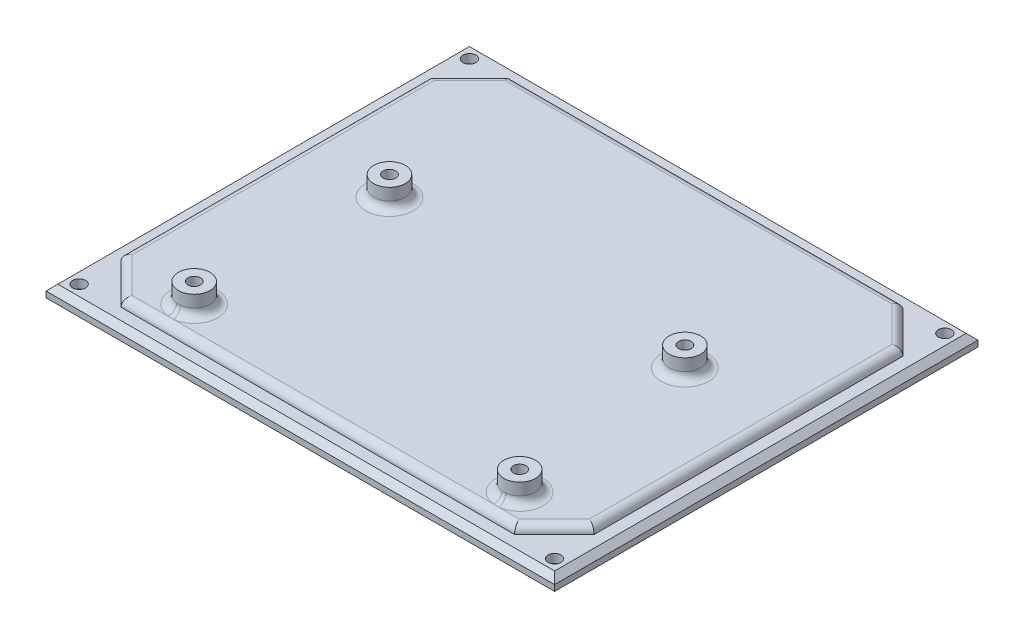
from build123d import *

# Parameters (mm, degrees)
SKETCH1_W                    = 129
SKETCH1_H                    = 107.4
SKETCH1_R                    = 1.65
BOSS_EXTRUDE1_DEPTH          = 3
BOSS_EXTRUDE2_DEPTH          = 5
BOSS_EXTRUDE3_START          = 5
SKETCH2_R                    = 4
SKETCH2_R_2                  = 1.6
BOSS_EXTRUDE3_DEPTH          = 5
CUT_EXTRUDE1_START           = 3
CUT_EXTRUDE1_OUTLINE_R       = 1.6
CUT_EXTRUDE1_DEPTH           = 2
FILLET3_R                    = 2
FILLET4_R                    = 2
SKETCH1_4_R                  = 2.407849471
CUT_EXTRUDE2_DEPTH           = 1
CUT_EXTRUDE2_DRAFT           = 45
CUT_EXTRUDE2_PROFILE_2_DEPTH = 1
CUT_EXTRUDE2_PROFILE_2_DRAFT = 45
CUT_EXTRUDE2_PROFILE_3_DEPTH = 1
CUT_EXTRUDE2_PROFILE_3_DRAFT = 45
CUT_EXTRUDE2_PROFILE_4_DEPTH = 1
CUT_EXTRUDE2_PROFILE_4_DRAFT = 45
CHAMFER1_SIZE                = 1.5


# Read off the part's stored shape, not the designer's step: Cut-Extrude1
with BuildPart() as part:
    # Sketch1 → Boss-Extrude1 (new body)
    with BuildSketch(Plane(origin=(0, 0, 0), x_dir=(1, 0, 0), z_dir=(0, 1, 0))):
        Rectangle(SKETCH1_W, SKETCH1_H)
        with Locations(Location((-60.3, -49.5, 0), (0, 0, 270))):
            Circle(SKETCH1_R, mode=Mode.SUBTRACT)
        with Locations(Location((60.3, -49.5, 0), (0, 0, 270))):
            Circle(SKETCH1_R, mode=Mode.SUBTRACT)
        with Locations(Location((-60.3, 49.5, 0), (0, 0, 270))):
            Circle(SKETCH1_R, mode=Mode.SUBTRACT)
        Polygon((49.912004588, -49.253731343), (-49.912004588, -49.253731343), (-60, -39.165735931), (-60, 39.165735931), (-49.912004588, 49.253731343), (49.912004588, 49.253731343), (60, 39.165735931), (60, -39.165735931), align=None, mode=Mode.SUBTRACT)
        with Locations(Location((60.3, 49.5, 0), (0, 0, 270))):
            Circle(SKETCH1_R, mode=Mode.SUBTRACT)
    extrude(amount=BOSS_EXTRUDE1_DEPTH)

    # Sketch1<3> → Boss-Extrude2 (add)
    with BuildSketch(Plane(origin=(0, 0, 0), x_dir=(1, 0, 0), z_dir=(0, 1, 0))):
        Polygon((-49.912004588, 49.253731343), (-60, 39.165735931), (-60, -39.165735931), (-49.912004588, -49.253731343), (49.912004588, -49.253731343), (60, -39.165735931), (60, 39.165735931), (49.912004588, 49.253731343), align=None)
    extrude(amount=BOSS_EXTRUDE2_DEPTH)

    # Sketch2 → Boss-Extrude3 (add)
    # profile 1 of 4: a face of its own
    with BuildSketch(Plane(origin=(0, 0, 0), x_dir=(1, 0, 0), z_dir=(0, 1, 0)).offset(BOSS_EXTRUDE3_START)):
        with Locations(Location((-39.313021369, -41.297235267, 0), (0, 0, 270))):
            Circle(SKETCH2_R)
        with Locations(Location((-39.313021369, -41.297235267, 0), (0, 0, 270))):
            Circle(SKETCH2_R_2, mode=Mode.SUBTRACT)
    # profile 2 of 4: a face of its own
    with BuildSketch(Plane(origin=(0, 0, 0), x_dir=(1, 0, 0), z_dir=(0, 1, 0)).offset(BOSS_EXTRUDE3_START)):
        with Locations(Location((36.886978631, 6.962764733, 0), (0, 0, 270))):
            Circle(SKETCH2_R)
        with Locations(Location((36.886978631, 6.962764733, 0), (0, 0, 270))):
            Circle(SKETCH2_R_2, mode=Mode.SUBTRACT)
    # profile 3 of 4: a face of its own
    with BuildSketch(Plane(origin=(0, 0, 0), x_dir=(1, 0, 0), z_dir=(0, 1, 0)).offset(BOSS_EXTRUDE3_START)):
        with Locations(Location((-38.043021369, 6.962764733, 0), (0, 0, 270))):
            Circle(SKETCH2_R)
        with Locations(Location((-38.043021369, 6.962764733, 0), (0, 0, 270))):
            Circle(SKETCH2_R_2, mode=Mode.SUBTRACT)
    # profile 4 of 4: a face of its own
    with BuildSketch(Plane(origin=(0, 0, 0), x_dir=(1, 0, 0), z_dir=(0, 1, 0)).offset(BOSS_EXTRUDE3_START)):
        with Locations(Location((43.236978631, -41.297235267, 0), (0, 0, 270))):
            Circle(SKETCH2_R)
        with Locations(Location((43.236978631, -41.297235267, 0), (0, 0, 270))):
            Circle(SKETCH2_R_2, mode=Mode.SUBTRACT)
    extrude(amount=BOSS_EXTRUDE3_DEPTH)

    # Cut-Extrude1 outline → Cut-Extrude1 (cut)
    with BuildSketch(Plane(origin=(0, 0, 0), x_dir=(1, 0, 0), z_dir=(0, 1, 0)).offset(CUT_EXTRUDE1_START)):
        with Locations((-38.043021369, 6.962764733)):
            Circle(CUT_EXTRUDE1_OUTLINE_R)
        with Locations((-39.313021369, -41.297235267)):
            Circle(CUT_EXTRUDE1_OUTLINE_R)
        with Locations((43.236978631, -41.297235267)):
            Circle(CUT_EXTRUDE1_OUTLINE_R)
        with Locations((36.886978631, 6.962764733)):
            Circle(CUT_EXTRUDE1_OUTLINE_R)
    extrude(amount=CUT_EXTRUDE1_DEPTH, mode=Mode.SUBTRACT)

    # Fillet3
    fillet3_edges = [part.edges().sort_by_distance(p)[0] for p in [
        (-54.956002294, 5, -44.209733637),
        (54.956002294, 5, -44.209733637),
        (0, 5, -49.253731343),
        (54.956002294, 5, 44.209733637),
        (60, 5, 0),
        (-60, 5, 0),
        (-54.956002294, 5, 44.209733637),
        (0, 5, 49.253731343),
    ]]
    fillet(fillet3_edges, radius=FILLET3_R - 0.0001)  # a hair under: the kernel refuses the full size

    # Fillet4
    fillet4_edges = [part.edges().sort_by_distance(p)[0] for p in [
        (-39.313021369, 5, 37.297235267),
        (43.236978631, 5, 37.297235267),
        (36.886978631, 5, -10.962764733),
        (-38.043021369, 5, -10.962764733),
    ]]
    fillet(fillet4_edges, radius=FILLET4_R)


with BuildPart() as cut_extrude2_tool:
    # Sketch1<4> → Cut-Extrude2 (with draft: the straight prism first)
    with BuildSketch(Plane(origin=(0, 0, 0), x_dir=(1, 0, 0), z_dir=(0, 1, 0))):
        with Locations((-60.3, 49.5)):
            Circle(SKETCH1_4_R)
    extrude(amount=CUT_EXTRUDE2_DEPTH)
    # Cut-Extrude2: the draft: its side faces are tilted about the plane it starts from
    cut_extrude2_sides = [cut_extrude2_tool.faces().sort_by_distance(p)[0] for p in [
        (-62.707849471, 0.5, -49.5),
    ]]
    draft(cut_extrude2_sides, Plane(origin=(0, 0, 0), x_dir=(1, 0, 0), z_dir=(0, 1, 0)), CUT_EXTRUDE2_DRAFT)


with BuildPart() as part_1:
    add(part.part)

    # Cut-Extrude2: cut by cut_extrude2_tool
    add(cut_extrude2_tool.part, mode=Mode.SUBTRACT)


with BuildPart() as cut_extrude2_profile_2_tool:
    # Sketch1<4> → Cut-Extrude2 profile 2 (with draft: the straight prism first)
    with BuildSketch(Plane(origin=(0, 0, 0), x_dir=(1, 0, 0), z_dir=(0, 1, 0))):
        with Locations((-60.3, -49.5)):
            Circle(SKETCH1_4_R)
    extrude(amount=CUT_EXTRUDE2_PROFILE_2_DEPTH)
    # Cut-Extrude2 profile 2: the draft: its side faces are tilted about the plane it starts from
    cut_extrude2_profile_2_sides = [cut_extrude2_profile_2_tool.faces().sort_by_distance(p)[0] for p in [
        (-62.707849471, 0.5, 49.5),
    ]]
    draft(cut_extrude2_profile_2_sides, Plane(origin=(0, 0, 0), x_dir=(1, 0, 0), z_dir=(0, 1, 0)), CUT_EXTRUDE2_PROFILE_2_DRAFT)


with BuildPart() as part_2:
    add(part_1.part)

    # Cut-Extrude2 profile 2: cut by cut_extrude2_profile_2_tool
    add(cut_extrude2_profile_2_tool.part, mode=Mode.SUBTRACT)


with BuildPart() as cut_extrude2_profile_3_tool:
    # Sketch1<4> → Cut-Extrude2 profile 3 (with draft: the straight prism first)
    with BuildSketch(Plane(origin=(0, 0, 0), x_dir=(1, 0, 0), z_dir=(0, 1, 0))):
        with Locations((60.3, -49.5)):
            Circle(SKETCH1_4_R)
    extrude(amount=CUT_EXTRUDE2_PROFILE_3_DEPTH)
    # Cut-Extrude2 profile 3: the draft: its side faces are tilted about the plane it starts from
    cut_extrude2_profile_3_sides = [cut_extrude2_profile_3_tool.faces().sort_by_distance(p)[0] for p in [
        (57.892150529, 0.5, 49.5),
    ]]
    draft(cut_extrude2_profile_3_sides, Plane(origin=(0, 0, 0), x_dir=(1, 0, 0), z_dir=(0, 1, 0)), CUT_EXTRUDE2_PROFILE_3_DRAFT)


with BuildPart() as part_3:
    add(part_2.part)

    # Cut-Extrude2 profile 3: cut by cut_extrude2_profile_3_tool
    add(cut_extrude2_profile_3_tool.part, mode=Mode.SUBTRACT)


with BuildPart() as cut_extrude2_profile_4_tool:
    # Sketch1<4> → Cut-Extrude2 profile 4 (with draft: the straight prism first)
    with BuildSketch(Plane(origin=(0, 0, 0), x_dir=(1, 0, 0), z_dir=(0, 1, 0))):
        with Locations((60.3, 49.5)):
            Circle(SKETCH1_4_R)
    extrude(amount=CUT_EXTRUDE2_PROFILE_4_DEPTH)
    # Cut-Extrude2 profile 4: the draft: its side faces are tilted about the plane it starts from
    cut_extrude2_profile_4_sides = [cut_extrude2_profile_4_tool.faces().sort_by_distance(p)[0] for p in [
        (57.892150529, 0.5, -49.5),
    ]]
    draft(cut_extrude2_profile_4_sides, Plane(origin=(0, 0, 0), x_dir=(1, 0, 0), z_dir=(0, 1, 0)), CUT_EXTRUDE2_PROFILE_4_DRAFT)


with BuildPart() as part_4:
    add(part_3.part)

    # Cut-Extrude2 profile 4: cut by cut_extrude2_profile_4_tool
    add(cut_extrude2_profile_4_tool.part, mode=Mode.SUBTRACT)

    # Chamfer1
    chamfer1_edges = [part_4.edges().sort_by_distance(p)[0] for p in [
        (0, 3, 53.7),
        (64.5, 3, 0),
        (0, 3, -53.7),
        (-64.5, 3, 0),
    ]]
    chamfer(chamfer1_edges, length=CHAMFER1_SIZE)


solid = part_4.part
